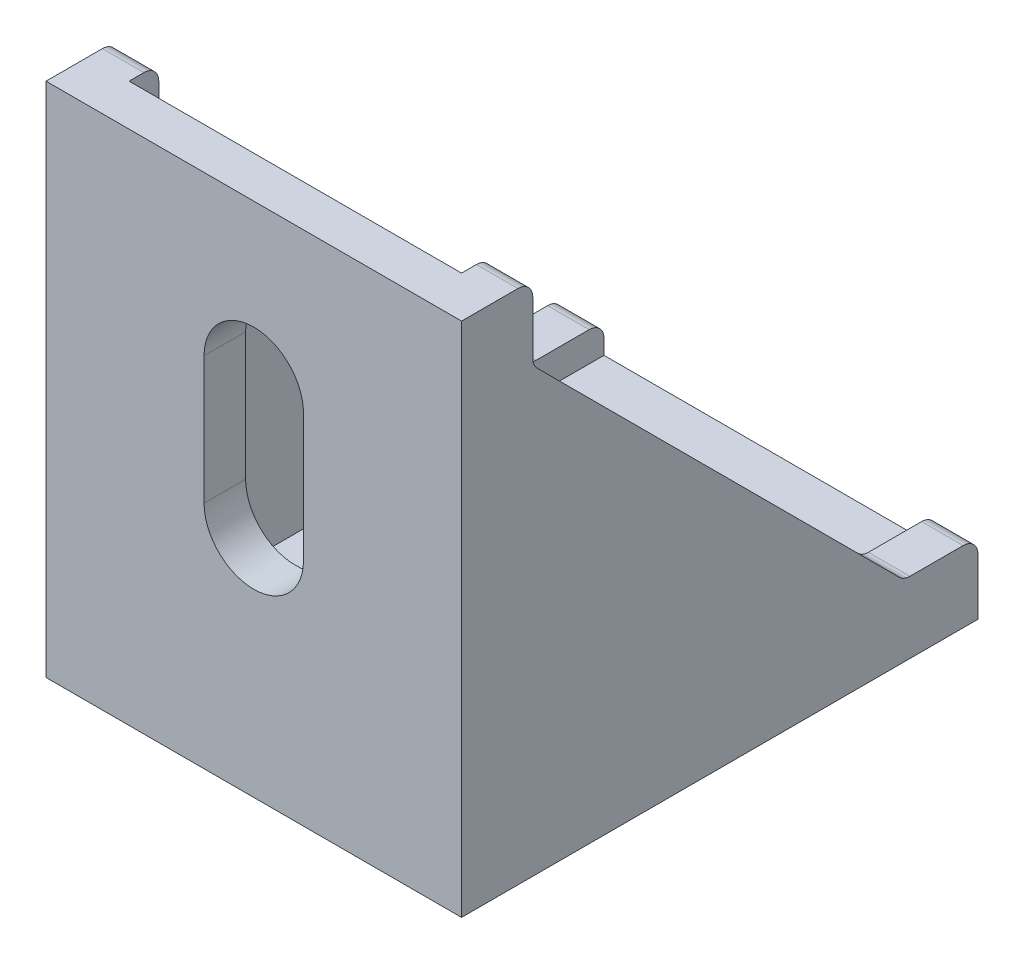
from build123d import *

# Parameters (mm, degrees)
EXTRUDE_1_DEPTH     = 14
EXTRUDE_3_DEPTH     = 2.8
FILLET_1_R          = 1
CUT_EXTRUDE_1_DEPTH = 2.8
CUT_EXTRUDE_2_DEPTH = 2.8


with BuildPart() as part:
    # 草图1 → 凸台-拉伸1 (new, symmetric)
    with BuildSketch(Plane(origin=(0, 0, 0), x_dir=(0, 0, -1), z_dir=(1, 0, 0))):
        Polygon((0, 34.8), (0, 0), (34.8, 0), (34.8, 2.8), (2.8, 2.8), (2.8, 34.8), align=None)
    extrude(amount=EXTRUDE_1_DEPTH, both=True)

    # 草图2 → 凸台-拉伸3 (add)
    with BuildSketch(Plane(origin=(14, 0, 0), x_dir=(0, 0, -1), z_dir=(1, 0, 0))):
        Polygon((2.8, 34.8), (4.8, 34.8), (4.8, 29.8), (29.8, 4.8), (34.8, 4.8), (34.8, 2.8), (2.8, 2.8), align=None)
    extrude_3 = extrude(amount=-EXTRUDE_3_DEPTH)

    # 镜向1: 凸台-拉伸3 across plane
    add(extrude_3.mirror(Plane(origin=(0, 0, 0), x_dir=(0, 0, 1), z_dir=(1, 0, 0))))

    # 圆角1
    fillet_1_edges = [part.edges().sort_by_distance(p)[0] for p in [
        (12.6, 29.8, -4.8),
        (-12.6, 29.8, -4.8),
        (-12.6, 4.8, -29.8),
        (12.6, 4.8, -29.8),
        (12.6, 4.8, -34.8),
        (-12.6, 4.8, -34.8),
        (-12.6, 34.8, -4.8),
        (12.6, 34.8, -4.8),
    ]]
    fillet(fillet_1_edges, radius=FILLET_1_R)

    # 草图3 → 切除-拉伸1 (cut)
    with BuildSketch(Plane(origin=(0, 2.8, 0), x_dir=(1, 0, 0), z_dir=(0, 1, 0))):
        with BuildLine():
            Line((-3.35, 15.5), (-3.35, 24.1))
            ThreePointArc((-3.35, 24.1), (0, 27.45), (3.35, 24.1))
            Line((3.35, 24.1), (3.35, 15.5))
            ThreePointArc((3.35, 15.5), (0, 12.15), (-3.35, 15.5))
        make_face()
    extrude(amount=-CUT_EXTRUDE_1_DEPTH, mode=Mode.SUBTRACT)

    # 草图4 → 切除-拉伸2 (cut)
    with BuildSketch(Plane(origin=(0, 0, -2.8), x_dir=(-1, 0, 0), z_dir=(0, 0, -1))):
        with BuildLine():
            Line((-3.35, 15.5), (-3.35, 24.1))
            ThreePointArc((-3.35, 24.1), (0, 27.45), (3.35, 24.1))
            Line((3.35, 24.1), (3.35, 15.5))
            ThreePointArc((3.35, 15.5), (0, 12.15), (-3.35, 15.5))
        make_face()
    extrude(amount=-CUT_EXTRUDE_2_DEPTH, mode=Mode.SUBTRACT)


solid = part.part
